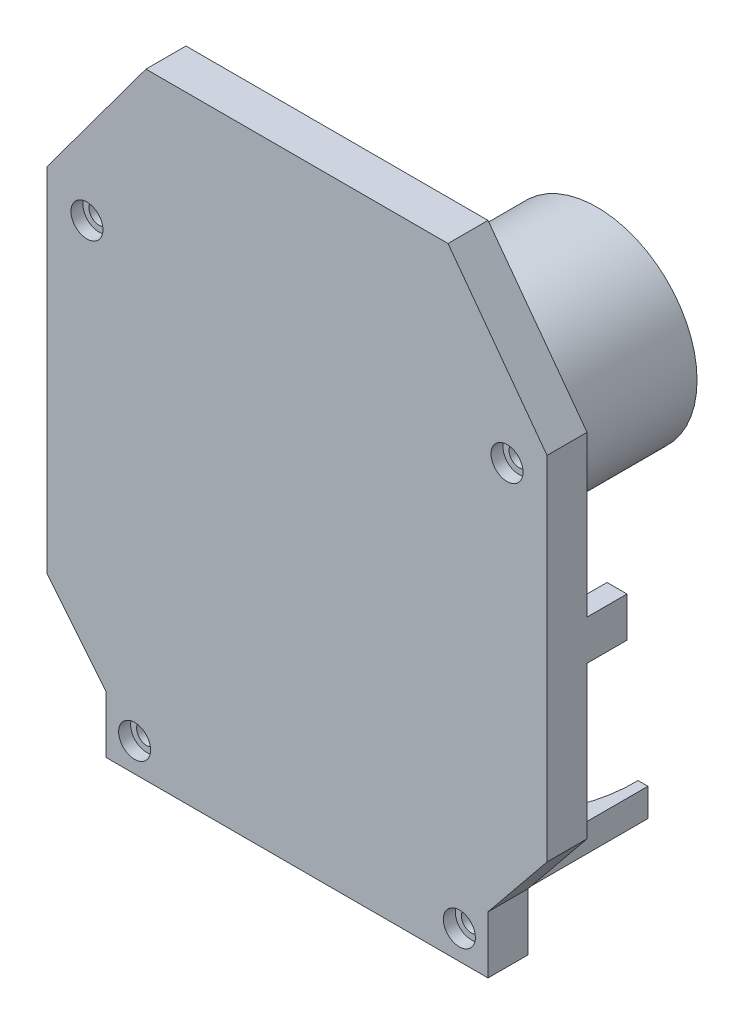
from build123d import *

# Parameters (mm, degrees)
ESTRUSIONE_ESTRUSIONE1_DEPTH      = 30
ESTRUSIONE_ESTRUSIONE1_DEPTH_BACK = 55
SCHIZZO1_R                        = 25
SCHIZZO1_R_2                      = 20
ESTRUSIONE_ESTRUSIONE2_DEPTH      = 10
ESTRUSIONE_ESTRUSIONE3_DEPTH      = 10
ESTRUSIONE_ESTRUSIONE5_DEPTH      = 42.5
TAGLIO_ESTRUSIONE1_DEPTH          = 26.5
SCHIZZO3D5_R                      = 2.5
TAGLIO_ESTRUSIONE2_DEPTH          = 35.5
SCHIZZO3D6_R                      = 4
TAGLIO_ESTRUSIONE3_DEPTH          = 3
ESTRUSIONE_ESTRUSIONE10_DEPTH     = 5
TAGLIO_ESTRUSIONE4_START          = -14
TAGLIO_ESTRUSIONE4_DEPTH          = 14
TAGLIO_ESTRUSIONE7_DEPTH          = 3
ESTRUSIONE_ESTRUSIONE11_START     = 30
ESTRUSIONE_ESTRUSIONE11_OUTLINE_R = 4
ESTRUSIONE_ESTRUSIONE11_DEPTH     = 10
ESTRUSIONE_ESTRUSIONE12_DEPTH     = 10
ESTRUSIONE_ESTRUSIONE13_DEPTH     = 10
ESTRUSIONE_ESTRUSIONE14_DEPTH     = 10
TAGLIO_ESTRUSIONE11_DEPTH         = 80
SCHIZZO3D17_R                     = 4
TAGLIO_ESTRUSIONE12_DEPTH         = 3
TAGLIO_ESTRUSIONE13_START         = 30
TAGLIO_ESTRUSIONE13_OUTLINE_R     = 2.5
TAGLIO_ESTRUSIONE13_DEPTH         = 7
TAGLIO_ESTRUSIONE14_START         = -55
TAGLIO_ESTRUSIONE14_OUTLINE_R     = 25
TAGLIO_ESTRUSIONE14_OUTLINE_R_2   = 20
TAGLIO_ESTRUSIONE14_DEPTH         = 20


# Read off the part's stored shape, not the designer's step: Estrusione-Estrusione11, Taglio-Estrusione13, Taglio-Estrusione14
with BuildPart() as part:
    # Schizzo1 → Estrusione-Estrusione1 (new, two sides: drawn at the far end of the back side and taken through both)
    with BuildSketch(Plane.XY.offset(-ESTRUSIONE_ESTRUSIONE1_DEPTH_BACK)):
        Circle(SCHIZZO1_R)
        Circle(SCHIZZO1_R_2, mode=Mode.SUBTRACT)
    extrude(amount=ESTRUSIONE_ESTRUSIONE1_DEPTH + ESTRUSIONE_ESTRUSIONE1_DEPTH_BACK)

    # Schizzo3D1 → Estrusione-Estrusione2 (add)
    with BuildSketch(Plane(origin=(-37.75, 73.5, 30), x_dir=(0.4568693936855125, -0.889533786381064, 0), z_dir=(0, 0, -1))):
        Polygon((0, 0), (34.493639223, -67.159800872), (75.600538561, -73.870637396), (146.763241471, -37.321085901), (165.255105821, 0), (130.761466598, 67.159800872), (89.654567261, 73.870637396), (18.49186435, 37.321085901), align=None)
    extrude(amount=-ESTRUSIONE_ESTRUSIONE2_DEPTH)

    # Schizzo3D2 → Estrusione-Estrusione3 (add)
    with BuildSketch(Plane(origin=(62.5, 0, 30), x_dir=(-0.9968152785361251, -0.07974522228289001, 0), z_dir=(0, 0, 1))):
        Polygon((0, 0), (0.797452223, 9.968152785), (5.781528616, 9.569426674), (4.984076393, -0.398726111), align=None)
        Polygon((125.39936204, 0), (120.415285647, 0.398726111), (119.617833424, -9.569426674), (124.601909817, -9.968152785), align=None)
    extrude(amount=-ESTRUSIONE_ESTRUSIONE3_DEPTH)

    # Schizzo3D3 → Estrusione-Estrusione5 (add)
    with BuildSketch(Plane(origin=(35.227450684, -68.5, 30), x_dir=(-0.9974912873801348, -0.0707893466612134, 0), z_dir=(0, 0, 1))):
        Polygon((0, 0), (70.278150268, -4.987456437), (70.632097001, 0), (0.353946733, 4.987456437), align=None)
    extrude(amount=-ESTRUSIONE_ESTRUSIONE5_DEPTH)

    # Schizzo3D4 → Taglio-Estrusione1 (cut)
    with BuildSketch(Plane(origin=(32.75, -68.5, -12.5), x_dir=(-1, 0, 0), z_dir=(0, 1, 0))):
        with BuildLine():
            Line((0, 0), (65.5, 0))
            ThreePointArc((65.5, 0), (32.75, 32.75), (0, 0))
        make_face()
    extrude(amount=-TAGLIO_ESTRUSIONE1_DEPTH, mode=Mode.SUBTRACT)

    # Schizzo3D5 → Taglio-Estrusione2 (cut)
    with BuildSketch(Plane(origin=(-52.5, 33.353317087, 40), x_dir=(0.8440673996564301, -0.5362370975951146, 0), z_dir=(0, 0, -1))):
        with Locations(Location((0, 0, 0), (0, 0, 147.572152721))):
            Circle(SCHIZZO3D5_R)
        with Locations(Location((88.627076964, -56.304895247, 0), (0, 0, 147.572152721))):
            Circle(SCHIZZO3D5_R)
        with Locations(Location((124.397648864, 0, 0), (0, 0, 147.572152721))):
            Circle(SCHIZZO3D5_R)
        with Locations(Location((35.7705719, 56.304895247, 0), (0, 0, 147.572152721))):
            Circle(SCHIZZO3D5_R)
    extrude(amount=TAGLIO_ESTRUSIONE2_DEPTH, mode=Mode.SUBTRACT)

    # Schizzo3D6 → Taglio-Estrusione3 (cut)
    with BuildSketch(Plane(origin=(0, 73.5, 40), x_dir=(0, -1, 0), z_dir=(0, 0, -1))):
        with Locations(Location((40.146682913, 52.5, 0), (0, 0, 270))):
            Circle(SCHIZZO3D6_R)
        with Locations(Location((40.146682913, -52.5, 0), (0, 0, 270))):
            Circle(SCHIZZO3D6_R)
        with Locations(Location((106.853317087, -52.5, 0), (0, 0, 270))):
            Circle(SCHIZZO3D6_R)
        with Locations(Location((106.853317087, 52.5, 0), (0, 0, 270))):
            Circle(SCHIZZO3D6_R)
    extrude(amount=TAGLIO_ESTRUSIONE3_DEPTH, mode=Mode.SUBTRACT)

    # Schizzo3D7 → Estrusione-Estrusione10 (add)
    with BuildSketch(Plane(origin=(35.227450684, -73.5, -12.5), x_dir=(-0.8117651174974726, 0, 0.5839840700004706), z_dir=(0, 1, 0))):
        with BuildLine():
            Line((0, 0), (2.011108045, -1.446791734))
            ThreePointArc((2.011108045, -1.446791734), (47.721893936, 6.013037572), (55.181723242, -39.697748319))
            Line((55.181723242, -39.697748319), (57.192831287, -41.144540052))
            Line((57.192831287, -41.144540052), (82.012154262, -6.644522559))
            Line((82.012154262, -6.644522559), (84.059871804, -8.117651175))
            Line((84.059871804, -8.117651175), (89.899712504, 0))
            Line((89.899712504, 0), (28.611446133, 44.090797285))
            Line((28.611446133, 44.090797285), (22.771605433, 35.97314611))
            Line((22.771605433, 35.97314611), (24.819322975, 34.500017494))
            Line((24.819322975, 34.500017494), (0, 0))
        make_face()
    extrude(amount=-ESTRUSIONE_ESTRUSIONE10_DEPTH)

    # Schizzo3D8 → Taglio-Estrusione4 (cut)
    with BuildSketch(Plane(origin=(0, -78.5, 20.25), x_dir=(-0.707106781186551, 0, -0.7071067811865441), z_dir=(0, -1, 0)).offset(TAGLIO_ESTRUSIONE4_START)):
        with BuildLine():
            ThreePointArc((0, 46.315494168), (-0.707106781, -0.707106781), (46.315494168, 0))
            ThreePointArc((46.315494168, 0), (0, 0), (0, 46.315494168))
        make_face()
    extrude(amount=TAGLIO_ESTRUSIONE4_DEPTH, mode=Mode.SUBTRACT)

    # Schizzo3D9 → Taglio-Estrusione7 (cut)
    with BuildSketch(Plane(origin=(35.227450684, -68.5, -12.5), x_dir=(-0.8562730712113632, 0, 0.5165234046180869), z_dir=(0, -1, 0))):
        with BuildLine():
            Line((0, 0), (2.121374306, 1.279661262))
            ThreePointArc((2.121374306, 1.279661262), (13.749394894, 45.407843828), (58.20726047, 35.111944264))
            Line((58.20726047, 35.111944264), (60.328634776, 36.391605526))
            Line((60.328634776, 36.391605526), (82.280879472, 0))
            Line((82.280879472, 0), (21.952244696, -36.391605526))
            Line((21.952244696, -36.391605526), (0, 0))
        make_face()
    extrude(amount=TAGLIO_ESTRUSIONE7_DEPTH, mode=Mode.SUBTRACT)

    # Estrusione-Estrusione11 outline → Estrusione-Estrusione11 (add)
    with BuildSketch(Plane.XY.offset(ESTRUSIONE_ESTRUSIONE11_START)):
        with Locations((52.5, -33.353317087)):
            Circle(ESTRUSIONE_ESTRUSIONE11_OUTLINE_R)
        with Locations((-52.5, -33.353317087)):
            Circle(ESTRUSIONE_ESTRUSIONE11_OUTLINE_R)
    extrude(amount=ESTRUSIONE_ESTRUSIONE11_DEPTH)

    # Schizzo3D11 → Estrusione-Estrusione12 (add)
    with BuildSketch(Plane(origin=(-62.5, -40, 40), x_dir=(0.9979582700578467, -0.06386932928370219, 0), z_dir=(0, 0, -1))):
        Polygon((0, 0), (0.510954634, 7.98366616), (27.158436361, 36.840627497), (26.839089715, 31.850836147), align=None)
        Polygon((102.504285751, 32.018493137), (102.184939104, 27.028701786), (124.744783757, -7.98366616), (125.255738392, 0), align=None)
    extrude(amount=ESTRUSIONE_ESTRUSIONE12_DEPTH)

    # Schizzo3D12 → Estrusione-Estrusione13 (add)
    with BuildSketch(Plane(origin=(-37.75, -78.5, 40), x_dir=(0.9932296706390209, 0.11616721294023631, 0), z_dir=(0, 0, 1))):
        Polygon((0, 0), (-9.932296706, 1.161672129), (-8.770624577, 11.093968836), (1.161672129, 9.932296706), align=None)
        Polygon((74.988840133, -8.770624577), (84.92113684, -9.932296706), (86.082808969, 0), (76.150512263, 1.161672129), align=None)
    extrude(amount=-ESTRUSIONE_ESTRUSIONE13_DEPTH)

    # Schizzo3D15 → Estrusione-Estrusione14 (add)
    with BuildSketch(Plane(origin=(-49.75, -63.712121212, 40), x_dir=(0.9860632358712049, -0.16637095558783233, 0), z_dir=(0, 0, 1))):
        Polygon((0, 0), (4.627662115, -4.074759177), (2.768690441, -4.388409339), (4.432399997, -14.249041698), (98.601439022, 1.639384561), (96.937729467, 11.500016919), (95.078757792, 11.186366757), (98.113291969, 16.553910081), (100.573565494, 1.972126472), (100.906307405, 0), (2.793015436, -16.553910081), (2.460273525, -14.581783609), align=None)
    extrude(amount=-ESTRUSIONE_ESTRUSIONE14_DEPTH)

    # Schizzo3D16 → Taglio-Estrusione11 (cut)
    with BuildSketch(Plane(origin=(-49.75, -80.5, 40), x_dir=(0.9860632358712049, 0.16637095558783233, 0), z_dir=(0, 0, 1))):
        Polygon((0, 0), (1.972126472, -0.332741911), (4.35509632, 13.790870902), (2.793015436, 16.553910081), align=None)
        Polygon((98.113291969, -16.553910081), (96.141165497, -16.22116817), (98.524135346, -2.097555357), (100.906307405, 0), align=None)
    extrude(amount=-TAGLIO_ESTRUSIONE11_DEPTH, mode=Mode.SUBTRACT)

    # Schizzo3D17 → Taglio-Estrusione12 (cut)
    with BuildSketch(Plane(origin=(0, -80.5, 40), x_dir=(-0.9847878761773714, 0.17376086709631217, 0), z_dir=(0, 0, -1))):
        with Locations(Location((41.215356952, 0, 0), (0, 0, 169.993443701))):
            Circle(SCHIZZO3D17_R)
        with Locations(Location((-38.726539684, 14.10534554, 0), (0, 0, 169.993443701))):
            Circle(SCHIZZO3D17_R)
    extrude(amount=TAGLIO_ESTRUSIONE12_DEPTH, mode=Mode.SUBTRACT)

    # Taglio-Estrusione13 outline → Taglio-Estrusione13 (cut)
    with BuildSketch(Plane.XY.offset(TAGLIO_ESTRUSIONE13_START)):
        with Locations((-40.588383838, -73.338383838)):
            Circle(TAGLIO_ESTRUSIONE13_OUTLINE_R)
        with Locations((40.588383838, -73.338383838)):
            Circle(TAGLIO_ESTRUSIONE13_OUTLINE_R)
    extrude(amount=TAGLIO_ESTRUSIONE13_DEPTH, mode=Mode.SUBTRACT)

    # Taglio-Estrusione14 outline → Taglio-Estrusione14 (cut)
    with BuildSketch(Plane.XY.offset(TAGLIO_ESTRUSIONE14_START)):
        Circle(TAGLIO_ESTRUSIONE14_OUTLINE_R)
        Circle(TAGLIO_ESTRUSIONE14_OUTLINE_R_2, mode=Mode.SUBTRACT)
    extrude(amount=TAGLIO_ESTRUSIONE14_DEPTH, mode=Mode.SUBTRACT)


solid = part.part
